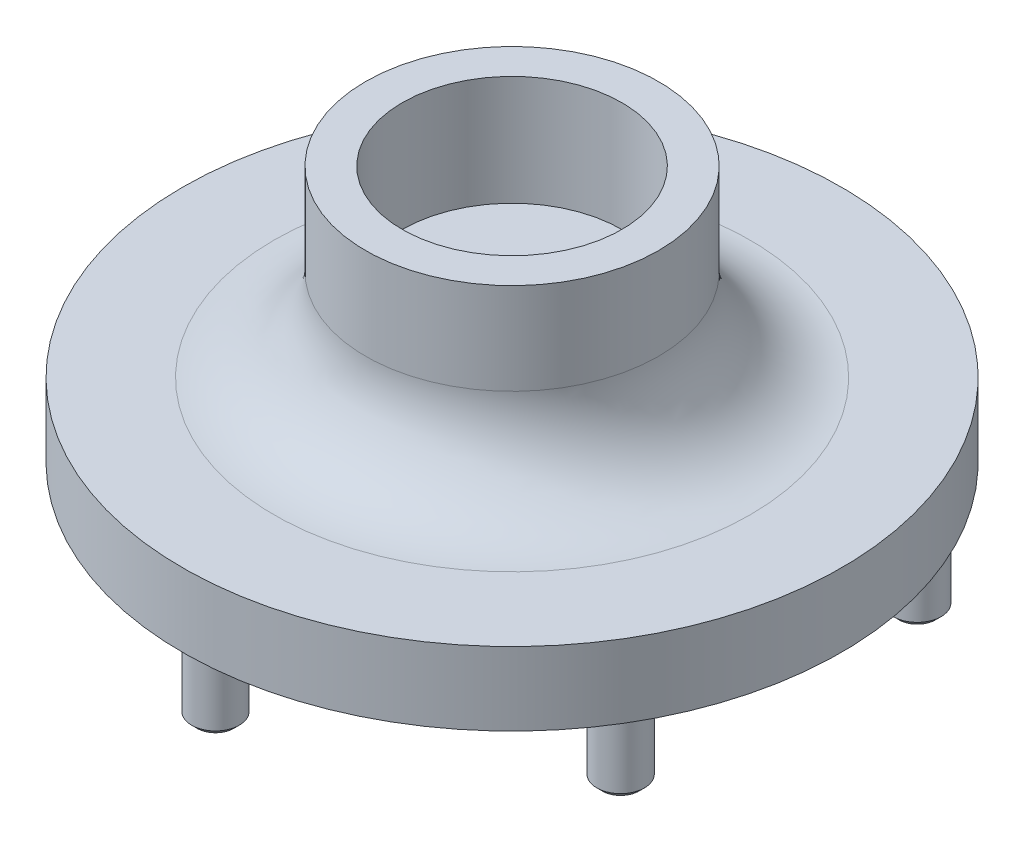
from build123d import *

# Parameters (mm, degrees)
SKETCH2_R           = 6.5000000000000036
BOSS_EXTRUDE2_DEPTH = 40
CIRPATTERN15_COUNT  = 6
CHAMFER1_SIZE       = 1.5
FILLET1_R           = 25
FILLET2_R           = 15


with BuildPart() as part:
    # Sketch1 → Revolve1 (revolve)
    with BuildSketch(Plane.XY):
        Polygon((2.8e-16, 75), (0, 0), (-30, 0), (-30, 29.999999999999996), (-50.00000000000002, 29.999999999999993), (-50.00000000000002, 34.99999999999999), (-90.00000000000003, 34.99999999999999), (-90.00000000000003, 54.99999999999999), (-40.000000000000014, 54.99999999999999), (-40, 105), (-30.000000000000004, 105), (-30, 75), align=None)
    revolve(axis=Axis((2.8e-16, 75, 0), (0, -1, 0)))

    # Sketch2 → Boss-Extrude2 (add)
    with BuildSketch(Plane(origin=(2.1e-16, 54.99999999999999, 0), x_dir=(1, 0, 0), z_dir=(0, 1, 0))):
        with Locations(Location((0, 81, 0), (0, 0, 180))):
            Circle(SKETCH2_R)
    boss_extrude2 = extrude(amount=-BOSS_EXTRUDE2_DEPTH)

    # CirPattern15: Boss-Extrude2 ×6 about axis
    cirpattern15_axis = Axis((9.552e-14, 0, 1.87e-15), (0, 1, 0))
    for i in range(1, CIRPATTERN15_COUNT):
        add(boss_extrude2.rotate(cirpattern15_axis, i * 360 / CIRPATTERN15_COUNT))

    # Chamfer1
    chamfer1_edges = [part.edges().sort_by_distance(p)[0] for p in [
        (6.5000000000000036, 14.999999999999993, -81),
        (73.39805770653957, 14.999999999999993, -34.870834875401236),
        (66.89805770653965, 14.999999999999993, 46.129165124598806),
        (-6.499999999999822, 14.999999999999993, 81),
        (-73.39805770653939, 14.999999999999993, 34.87083487540121),
        (-66.89805770653949, 14.999999999999993, -46.12916512459878),
    ]]
    chamfer(chamfer1_edges, length=CHAMFER1_SIZE)

    # Fillet1
    # the kernel refuses this fillet: 25 mm, written as the material it adds along each edge
    with BuildSketch(Plane(origin=(1.1e-16, 30, 0), x_dir=(-1, 0, 0), z_dir=(0, 0, 1))) as fillet1_piece_1:
        with BuildLine():
            CenterArc((55, 24.494897427831788), FILLET1_R, 180, 78.46304096718455)
            Line((30, 24.494897427831788), (29.5, 24.494897427831788))
            Line((29.5, 24.494897427831788), (29.5, 0))
            Line((29.5, 0), (30, -0.5))
            ThreePointArc((30, -0.5), (40.000000000000014, -0.5), (49.90000000000002, -0.4898979485566315))
            Line((49.90000000000002, -0.4898979485566315), (50.00000000000002, 3.55e-15))
        make_face()
    revolve(axis=Axis((1.1e-16, 30, 0), (0, -1, 0)))
    with BuildSketch(Plane(origin=(2.1e-16, 54.99999999999999, 0), x_dir=(-1, 0, 0), z_dir=(0, 0, 1))) as fillet1_piece_2:
        with BuildLine():
            CenterArc((40.000000000000014 + FILLET1_R, -FILLET1_R), FILLET1_R, 90, 89.99999999999997)
            Line((40.000000000000014, -FILLET1_R), (40.000000000000014 - FILLET1_R * 0.02, -FILLET1_R))
            Line((40.000000000000014 - FILLET1_R * 0.02, -FILLET1_R), (40.000000000000014 - FILLET1_R * 0.02, FILLET1_R * 0.02))
            Line((40.000000000000014 - FILLET1_R * 0.02, FILLET1_R * 0.02), (40.000000000000014 + FILLET1_R, FILLET1_R * 0.02))
            Line((40.000000000000014 + FILLET1_R, FILLET1_R * 0.02), (40.000000000000014 + FILLET1_R, -7.11e-15))
        make_face()
    revolve(axis=Axis((2.1e-16, 54.99999999999999, 0), (0, -1, 0)))

    # Fillet2
    fillet2_edges = [part.edges().sort_by_distance(p)[0] for p in [
        (30, -1.1e-16, -1.7e-14),
    ]]
    fillet(fillet2_edges, radius=FILLET2_R)


solid = part.part
